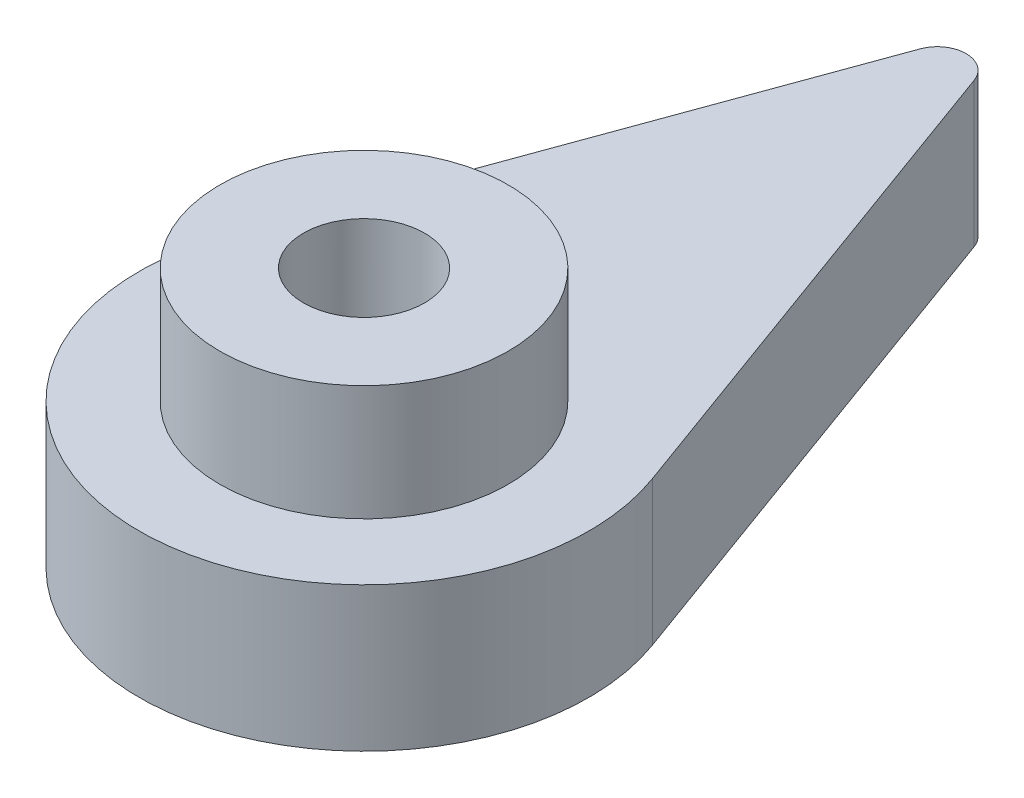
from build123d import *

# Parameters (mm, degrees)
BOSS_EXTRUDE2_DEPTH = 5
CUT_EXTRUDE1_REACH  = 24.845
SKETCH3_R           = 2.1
CUT_EXTRUDE3_DEPTH  = 1.8
BOSS_EXTRUDE3_START = 4
SKETCH6_R           = 5
SKETCH6_R_2         = 2.1
BOSS_EXTRUDE3_DEPTH = 4


with BuildPart() as part:
    # Sketch1 → Boss-Extrude2 (new body)
    with BuildSketch(Plane(origin=(0, 0, 0), x_dir=(1, 0, 0), z_dir=(0, 1, 0))):
        with BuildLine():
            Line((-0.939692556, 20.223890242), (-7.329602442, 2.667757118))
            ThreePointArc((-7.329602442, 2.667757118), (0, -7.8), (7.329602442, 2.667757118))
            Line((7.329602442, 2.667757118), (0.939692556, 20.223890242))
            ThreePointArc((0.939692556, 20.223890242), (0, 20.881870053), (-0.939692556, 20.223890242))
        make_face()
    extrude(amount=BOSS_EXTRUDE2_DEPTH)

    # Sketch3 → Cut-Extrude1 (cut, up to next)
    with BuildSketch(Plane(origin=(0, 5, 0), x_dir=(1, 0, 0), z_dir=(0, 1, 0)), mode=Mode.PRIVATE) as cut_extrude1_sk1:
        Circle(SKETCH3_R)
    cut_extrude1_tool1 = extrude(cut_extrude1_sk1.sketch, amount=-CUT_EXTRUDE1_REACH, mode=Mode.PRIVATE) & part.part
    add(cut_extrude1_tool1.solids().sort_by_distance((0, 5, 0))[0], mode=Mode.SUBTRACT)

    # Sketch5 → Cut-Extrude3 (cut)
    with BuildSketch(Plane.XZ):
        Polygon((0, 4.272391992), (-3.7, 2.136195996), (-3.7, -2.136195996), (0, -4.272391992), (3.7, -2.136195996), (3.7, 2.136195996), align=None)
    extrude(amount=-CUT_EXTRUDE3_DEPTH, mode=Mode.SUBTRACT)

    # Sketch6 → Boss-Extrude3 (add)
    with BuildSketch(Plane(origin=(0, 5, 0), x_dir=(1, 0, 0), z_dir=(0, 1, 0)).offset(BOSS_EXTRUDE3_START)):
        Circle(SKETCH6_R)
        Circle(SKETCH6_R_2, mode=Mode.SUBTRACT)
    extrude(amount=-BOSS_EXTRUDE3_DEPTH)


solid = part.part
